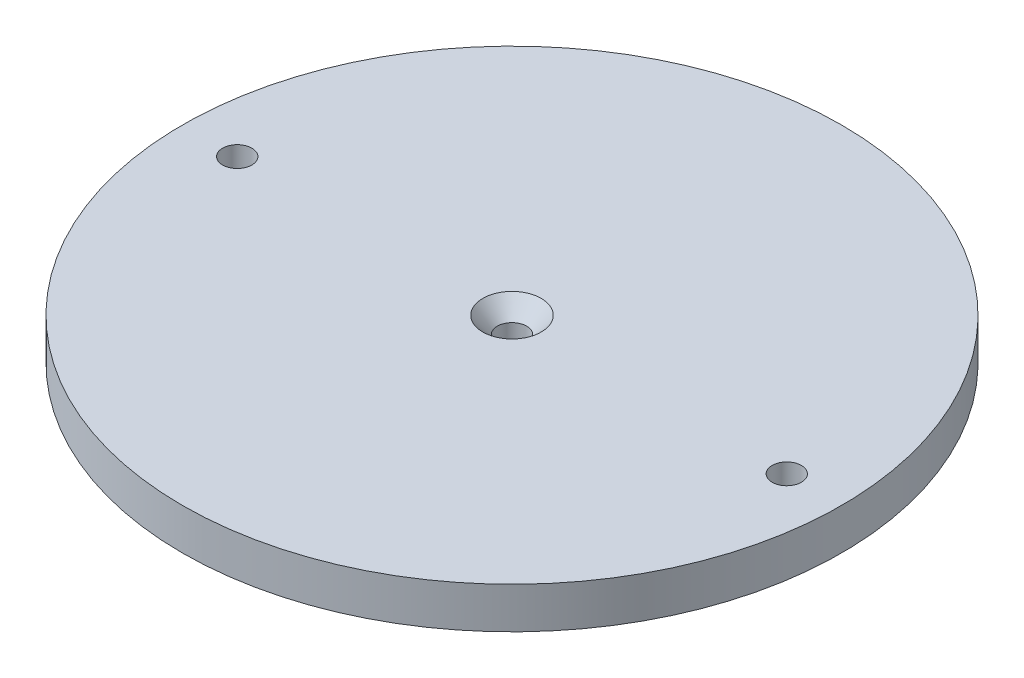
from build123d import *

# Parameters (mm, degrees)
SKETCH2_R                                        = 76.1619
BOSS_EXTRUDE1_DEPTH                              = 9.525
F_1_4_CLEARANCE_HOLE1_D                          = 6.7564
CSK_FOR_1_4_FLAT_HEAD_MACHINE_SCREW1_D           = 6.7564
CSK_FOR_1_4_FLAT_HEAD_MACHINE_SCREW1_CSINK_D     = 13.4874
CSK_FOR_1_4_FLAT_HEAD_MACHINE_SCREW1_CSINK_ANGLE = 82


with BuildPart() as part:
    # Sketch2 → Boss-Extrude1 (new body)
    with BuildSketch(Plane(origin=(0, 0, 0), x_dir=(1, 0, 0), z_dir=(0, 1, 0))):
        Circle(SKETCH2_R)
    extrude(amount=BOSS_EXTRUDE1_DEPTH)

    # 1/4 Clearance Hole1 (through all)
    with Locations(Plane(origin=(0, 9.525, 0), x_dir=(1, 0, 0), z_dir=(0, 1, 0))):
        with Locations((-63.5, 0), (63.5, 0)):
            Hole(F_1_4_CLEARANCE_HOLE1_D / 2)

    # CSK for 1/4 Flat Head Machine Screw1 (through all)
    with Locations(Plane(origin=(0, 9.525, 0), x_dir=(1, 0, 0), z_dir=(0, 1, 0))):
        with Locations((0, 0)):
            CounterSinkHole(CSK_FOR_1_4_FLAT_HEAD_MACHINE_SCREW1_D / 2, CSK_FOR_1_4_FLAT_HEAD_MACHINE_SCREW1_CSINK_D / 2, counter_sink_angle=CSK_FOR_1_4_FLAT_HEAD_MACHINE_SCREW1_CSINK_ANGLE)


solid = part.part
